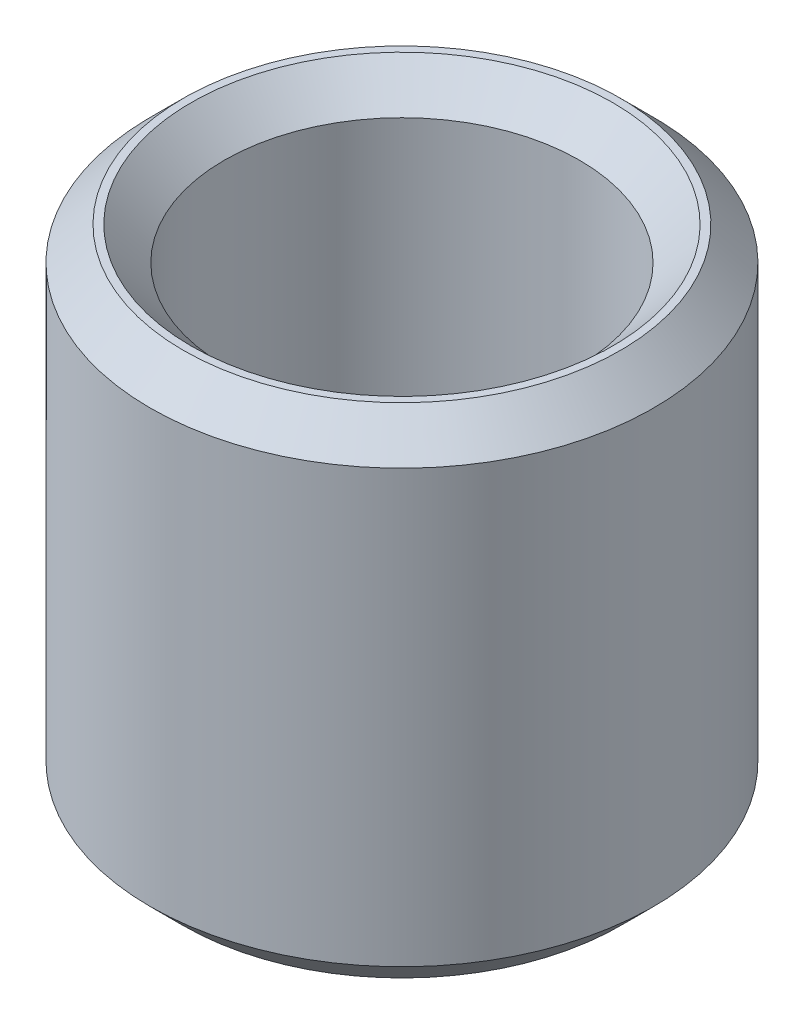
from build123d import *

# Parameters (mm, degrees)
SKETCH1_R           = 20
BOSS_EXTRUDE1_DEPTH = 39.585125433
SKETCH2_R           = 14.109287917
CUT_EXTRUDE1_DEPTH  = 49.651640831
CHAMFER1_SIZE       = 2.641248506


with BuildPart() as part:
    # Sketch1 → Boss-Extrude1 (new body)
    with BuildSketch(Plane(origin=(0, 0, 0), x_dir=(1, 0, 0), z_dir=(0, 1, 0))):
        Circle(SKETCH1_R)
    extrude(amount=BOSS_EXTRUDE1_DEPTH)

    # Sketch2 → Cut-Extrude1 (cut, through all)
    with BuildSketch(Plane(origin=(0, 0, 0), x_dir=(1, 0, 0), z_dir=(0, 1, 0))):
        Circle(SKETCH2_R)
    extrude(amount=CUT_EXTRUDE1_DEPTH, mode=Mode.SUBTRACT)

    # Chamfer1
    chamfer1_edges = [part.edges().sort_by_distance(p)[0] for p in [
        (-14.109287917, 39.585125433, 0),
        (-14.109287917, 0, 0),
        (-20, 0, 0),
        (-20, 39.585125433, 0),
    ]]
    chamfer(chamfer1_edges, length=CHAMFER1_SIZE)


solid = part.part
